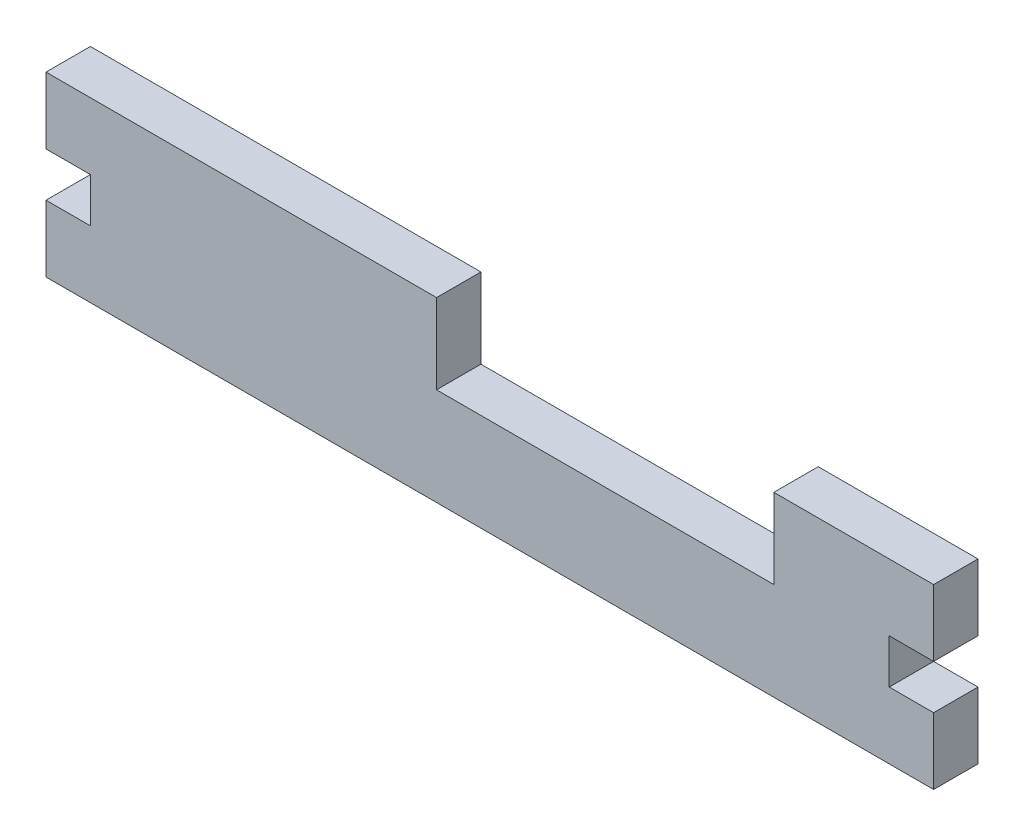
from build123d import *

# Parameters (mm, degrees)
BOSS_EXTRU_1_DEPTH = 5


with BuildPart() as part:
    # Esquisse1 → Boss.-Extru.1 (new body)
    with BuildSketch(Plane.XY):
        Polygon((0, 0), (90, 0), (95, 0), (95, 7.5), (90, 7.5), (90, 12.5), (95, 12.5), (95, 20), (90, 20), (77, 20), (77, 11), (39, 11), (39, 20), (0, 20), (-5, 20), (-5, 12.5), (0, 12.5), (0, 7.5), (-5, 7.5), (-5, 0), align=None)
    extrude(amount=BOSS_EXTRU_1_DEPTH)


solid = part.part
